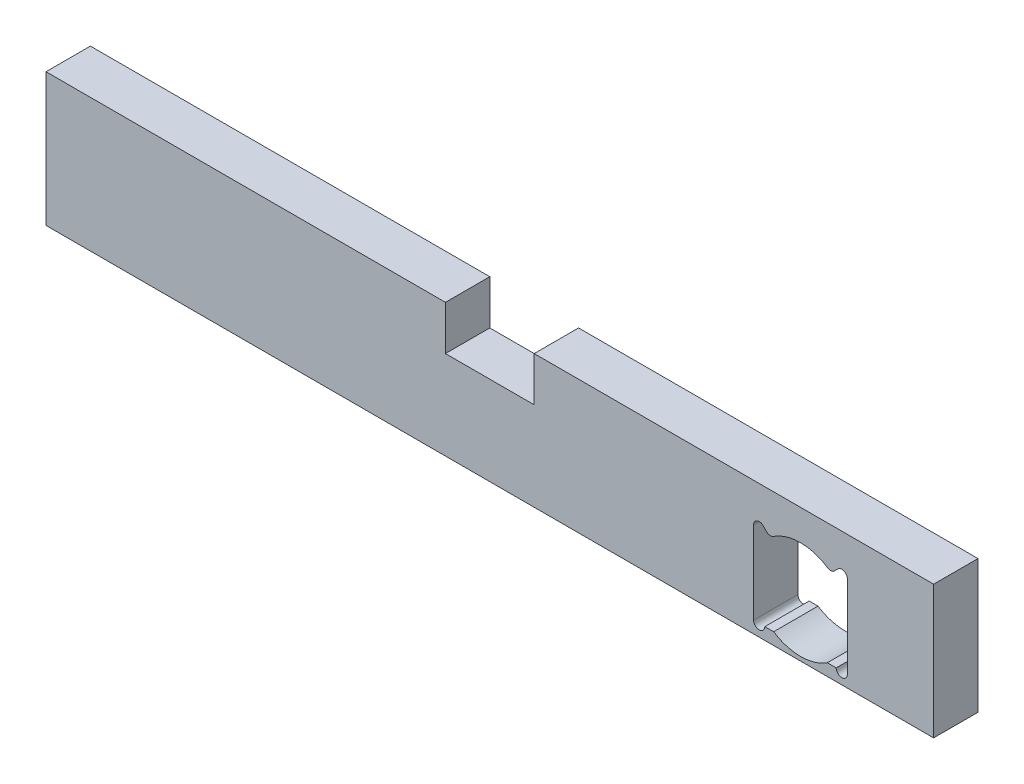
from build123d import *

# Parameters (mm, degrees)
SKETCH1_W           = 254
SKETCH1_H           = 38.1
BOSS_EXTRUDE1_DEPTH = 12.7
CUT_EXTRUDE4_DEPTH  = 218.110576665
FILLET1_R           = 1.5875
SKETCH6_W           = 25.4
SKETCH6_H           = 12.7
CUT_EXTRUDE5_DEPTH  = 218.110576665


with BuildPart() as part:
    # Sketch1 → Boss-Extrude1 (new body)
    with BuildSketch(Plane.XY):
        with Locations((-88.9, 0)):
            Rectangle(SKETCH1_W, SKETCH1_H)
    extrude(amount=BOSS_EXTRUDE1_DEPTH)

    # Sketch5 → Cut-Extrude4 (cut, through all)
    with BuildSketch(Plane.XY.offset(12.7)):
        with BuildLine():
            Line((-8.772142836, 7.225167378), (-10.687223205, 9.140247747))
            ThreePointArc((-10.687223205, 9.140247747), (-12.431105504, 9.487127504), (-13.418935476, 8.008735476))
            Line((-13.418935476, 8.008735476), (-13.418935476, -15.628735476))
            ThreePointArc((-13.418935476, -15.628735476), (-11.818735476, -17.228935476), (-10.218535476, -15.628735476))
            Line((-10.218535476, -15.628735476), (-7.683937842, -15.628735476))
            ThreePointArc((-7.683937842, -15.628735476), (0, -17.907), (7.683937842, -15.628735476))
            Line((7.683937842, -15.628735476), (10.218535476, -15.628735476))
            ThreePointArc((10.218535476, -15.628735476), (11.818735476, -17.228935476), (13.418935476, -15.628735476))
            Line((13.418935476, -15.628735476), (13.418935476, 8.008735476))
            ThreePointArc((13.418935476, 8.008735476), (12.571582801, 9.420776887), (10.926920796, 9.337383893))
            Line((10.926920796, 9.337383893), (8.795831767, 7.206294864))
            ThreePointArc((8.795831767, 7.206294864), (0.015143788, 10.286991866), (-8.772142836, 7.225167378))
        make_face()
    extrude(amount=-CUT_EXTRUDE4_DEPTH, mode=Mode.SUBTRACT)

    # Fillet1
    fillet1_edges = [part.edges().sort_by_distance(p)[0] for p in [
        (8.795831767, 7.206294864, 6.35),
        (-8.772142836, 7.225167378, 6.35),
    ]]
    fillet(fillet1_edges, radius=FILLET1_R)

    # Sketch6 → Cut-Extrude5 (cut, through all)
    with BuildSketch(Plane.XY.offset(12.7)):
        with Locations((-88.9, 12.7)):
            Rectangle(SKETCH6_W, SKETCH6_H)
    extrude(amount=-CUT_EXTRUDE5_DEPTH, mode=Mode.SUBTRACT)


solid = part.part
